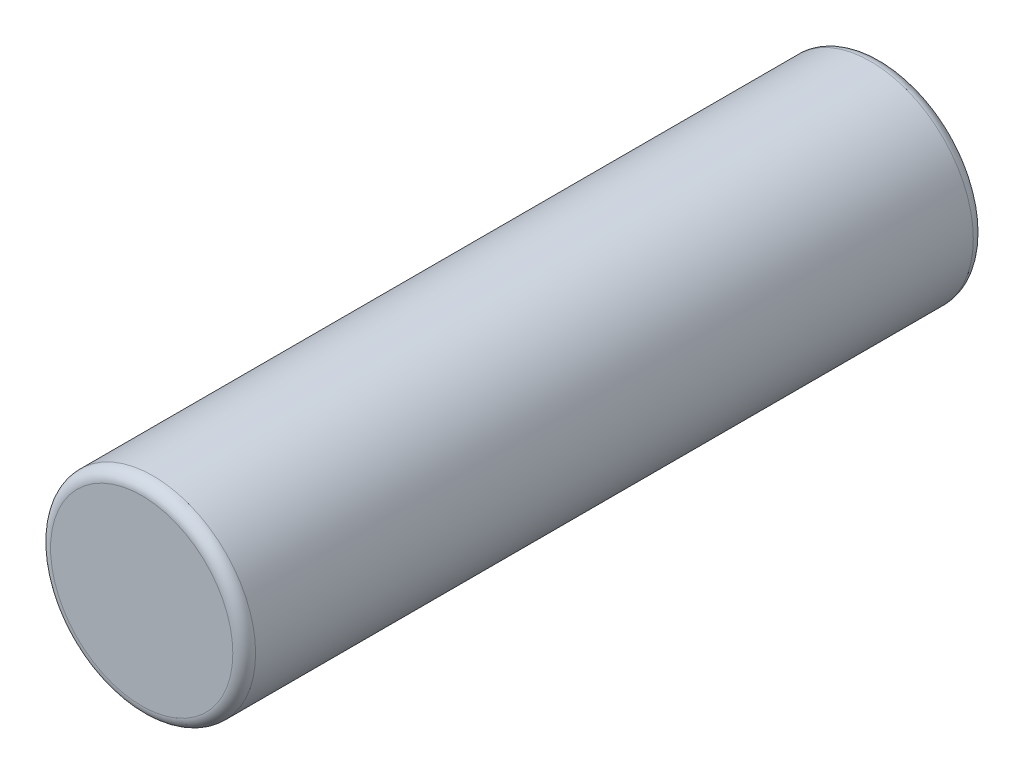
from build123d import *

# Parameters (mm, degrees)
SKETCH_1_R      = 9
EXTRUDE_1_DEPTH = 65
FILLET_1_R      = 1


with BuildPart() as part:
    # Эскиз1 → Бобышка-Вытянуть1 (new body)
    with BuildSketch(Plane.XY):
        Circle(SKETCH_1_R)
    extrude(amount=EXTRUDE_1_DEPTH)

    # Скругление1
    fillet_1_edges = [part.edges().sort_by_distance(p)[0] for p in [
        (-9, 0, 65),
        (-9, 0, 0),
    ]]
    fillet(fillet_1_edges, radius=FILLET_1_R)


solid = part.part
